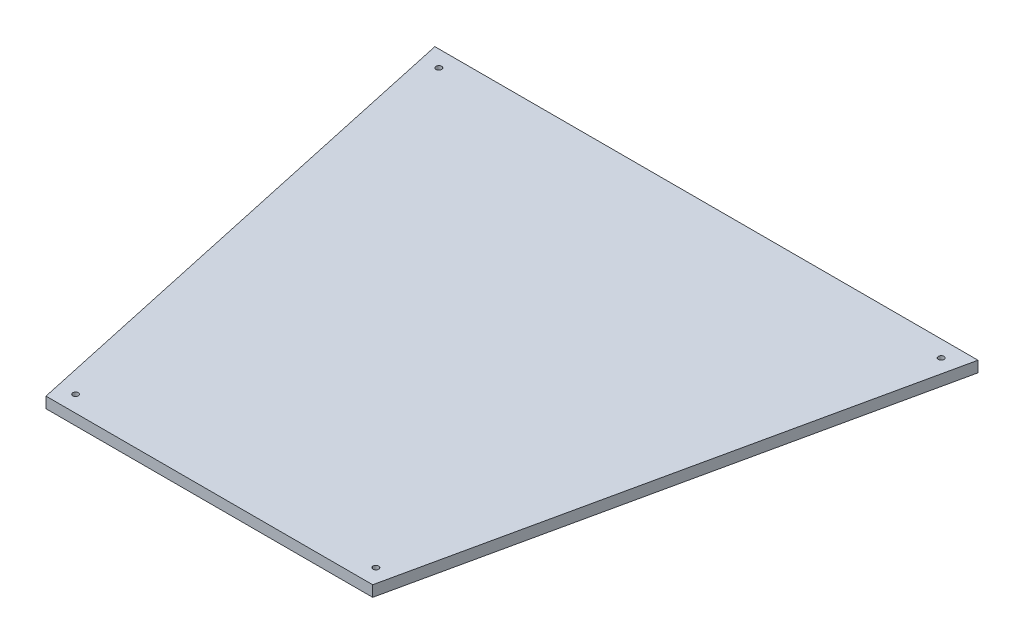
from build123d import *

# Parameters (mm, degrees)
BOSS_EXTRUDE1_DEPTH = 12.7
SKETCH2_R           = 3.2639
CUT_EXTRUDE1_DEPTH  = 695.226396558


with BuildPart() as part:
    # Sketch1 → Boss-Extrude1 (new body)
    with BuildSketch(Plane(origin=(4.555990946, 0, 422.877296058), x_dir=(-0.9999999994755782, 0, 3.2385856298737384e-05), z_dir=(0, -1, 0))):
        Polygon((-184.891152981, -195.663474972), (194.015807939, -195.651203746), (319.509878582, 380.901443858), (-310.422567663, 380.881042957), align=None)
    extrude(amount=BOSS_EXTRUDE1_DEPTH)

    # Sketch2 → Cut-Extrude1 (cut, through all)
    with BuildSketch(Plane(origin=(0, 0, 0), x_dir=(0.9999999994755782, 0, -3.238585631339118e-05), z_dir=(0, 1, 0))):
        with Locations((-174.123876891, -599.488508629)):
            Circle(SKETCH2_R)
        with Locations((174.085046589, -599.500979473)):
            Circle(SKETCH2_R)
        with Locations((291.320911655, -61.056515355)):
            Circle(SKETCH2_R)
        with Locations((-291.324865779, -61.037645873)):
            Circle(SKETCH2_R)
    extrude(amount=-CUT_EXTRUDE1_DEPTH, mode=Mode.SUBTRACT)


solid = part.part
